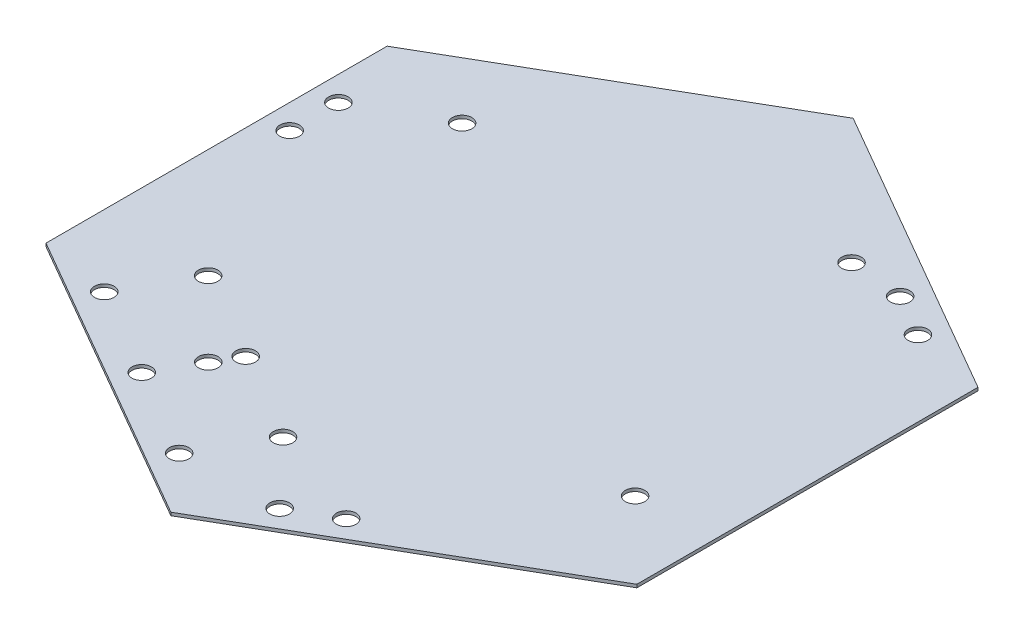
from build123d import *

# Parameters (mm, degrees)
SKETCH1_R           = 2.54
BOSS_EXTRUDE1_DEPTH = 0.8128
SKETCH2_R           = 2.54
CUT_EXTRUDE1_DEPTH  = 118.606454516
SKETCH3_R           = 2.54
CUT_EXTRUDE2_DEPTH  = 118.606454516
SKETCH5_R           = 2.54
CUT_EXTRUDE3_DEPTH  = 2.54


with BuildPart() as part:
    # Sketch1 → Boss-Extrude1 (new body)
    with BuildSketch(Plane(origin=(0, 0, 0), x_dir=(1, 0, 0), z_dir=(0, 1, 0))):
        Polygon((0, 88.9), (-76.989658396, 44.45), (-76.989658396, -44.45), (0, -88.9), (76.989658396, -44.45), (76.989658396, 44.45), align=None)
        with Locations((13.322783942, -73.875738686)):
            Circle(SKETCH1_R, mode=Mode.SUBTRACT)
        with Locations((24.32130657, -67.525738686)):
            Circle(SKETCH1_R, mode=Mode.SUBTRACT)
        with Locations((-70.639658396, 12.7)):
            Circle(SKETCH1_R, mode=Mode.SUBTRACT)
        with Locations((-70.639658396, 25.4)):
            Circle(SKETCH1_R, mode=Mode.SUBTRACT)
        with Locations((46.318351826, 54.825738686)):
            Circle(SKETCH1_R, mode=Mode.SUBTRACT)
        with Locations((57.316874454, 48.475738686)):
            Circle(SKETCH1_R, mode=Mode.SUBTRACT)
    extrude(amount=BOSS_EXTRUDE1_DEPTH)

    # Sketch2 → Cut-Extrude1 (cut, through all)
    with BuildSketch(Plane(origin=(0, 0.8128, 0), x_dir=(1, 0, 0), z_dir=(0, 1, 0))):
        with Locations((-49.850334746, 36.846687445)):
            Circle(SKETCH2_R)
        with Locations((-25.4, -43.994090512)):
            Circle(SKETCH2_R)
        with Locations((32.385, 56.092465403)):
            Circle(SKETCH2_R)
        with Locations((56.835334746, -24.748312555)):
            Circle(SKETCH2_R)
    extrude(amount=-CUT_EXTRUDE1_DEPTH, mode=Mode.SUBTRACT)

    # Sketch3 → Cut-Extrude2 (cut, through all)
    with BuildSketch(Plane(origin=(0, 0.8128, 0), x_dir=(1, 0, 0), z_dir=(0, 1, 0))):
        with Locations((-35.319829198, -61.175738686)):
            Circle(SKETCH3_R)
        with Locations((-28.969829198, -50.177216058)):
            Circle(SKETCH3_R)
    extrude(amount=-CUT_EXTRUDE2_DEPTH, mode=Mode.SUBTRACT)

    # Sketch5 → Cut-Extrude3 (cut)
    with BuildSketch(Plane(origin=(0, 0.8128, 0), x_dir=(1, 0, 0), z_dir=(0, 1, 0))):
        with Locations((-2.3169441, -57.353036215)):
            Circle(SKETCH5_R)
        with Locations((-12.222931679, -74.510738686)):
            Circle(SKETCH5_R)
        with Locations((-58.416726717, -47.840738686)):
            Circle(SKETCH5_R)
        with Locations((-48.510714297, -30.683050557)):
            Circle(SKETCH5_R)
    extrude(amount=-CUT_EXTRUDE3_DEPTH, mode=Mode.SUBTRACT)


solid = part.part
